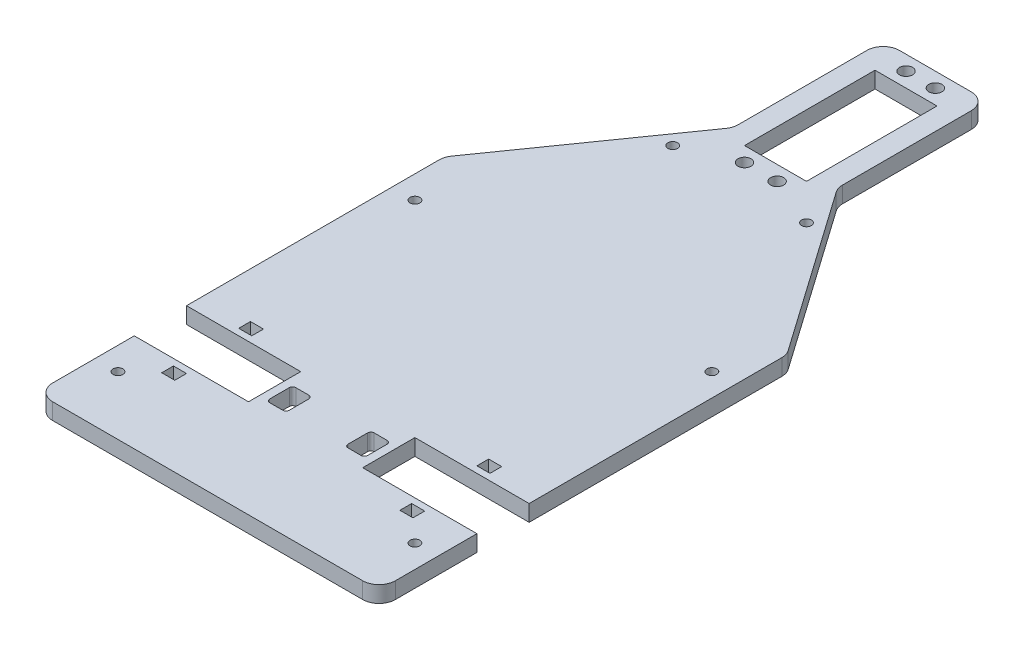
from build123d import *

# Parameters (mm, degrees)
BOSS_EXTRUDE1_DEPTH = 5
SKETCH2_R           = 2
SKETCH2_R_2         = 1.5
SKETCH2_W           = 19
SKETCH2_H           = 40
SKETCH2_W_2         = 3.995778709
SKETCH2_H_2         = 3.597560242
SKETCH2_W_3         = 35
SKETCH2_H_3         = 16
SKETCH2_W_4         = 6
SKETCH2_H_4         = 8
SKETCH2_H_5         = 3.6
SKETCH2_W_5         = 4
CUT_EXTRUDE1_DEPTH  = 7
FILLET1_R           = 5
FILLET2_R           = 5
FILLET3_R           = 5
FILLET4_R           = 5
FILLET5_R           = 5
FILLET6_R           = 5
FILLET8_R           = 1
FILLET9_R           = 1
FILLET10_R          = 5


with BuildPart() as part:
    # Sketch1 → Boss-Extrude1 (new body)
    with BuildSketch(Plane(origin=(0, 0, 0), x_dir=(1, 0, 0), z_dir=(0, 1, 0))):
        Polygon((-16, 108), (16, 108), (16, 62), (52.5, 10), (52.5, -115), (-52.5, -115), (-52.5, 10), (-16, 62), align=None)
    extrude(amount=BOSS_EXTRUDE1_DEPTH)

    # Sketch2 → Cut-Extrude1 (cut)
    with BuildSketch(Plane(origin=(0, 5, 0), x_dir=(1, 0, 0), z_dir=(0, 1, 0))):
        with Locations((-4.5, 103.5)):
            Circle(SKETCH2_R)
        with Locations((4.5, 103.5)):
            Circle(SKETCH2_R)
        with Locations((-5, 54.502551087)):
            Circle(SKETCH2_R)
        with Locations((5, 54.502551087)):
            Circle(SKETCH2_R)
        with Locations((-20.5, 48)):
            Circle(SKETCH2_R_2)
        with Locations((20.5, 48)):
            Circle(SKETCH2_R_2)
        with Locations((45.5, -6)):
            Circle(SKETCH2_R_2)
        with Locations((-45.5, -6)):
            Circle(SKETCH2_R_2)
        with Locations((45.5, -97)):
            Circle(SKETCH2_R_2)
        with Locations((-45.5, -97)):
            Circle(SKETCH2_R_2)
        with Locations((0, 79)):
            Rectangle(SKETCH2_W, SKETCH2_H)
        with Locations((-36.502110645, -65.201219879)):
            Rectangle(SKETCH2_W_2, SKETCH2_H_2)
        with Locations((-35, -77)):
            Rectangle(SKETCH2_W_3, SKETCH2_H_3)
        with Locations((35, -77)):
            Rectangle(SKETCH2_W_3, SKETCH2_H_3)
        with Locations((-12, -78)):
            Rectangle(SKETCH2_W_4, SKETCH2_H_4)
        with Locations((12, -78)):
            Rectangle(SKETCH2_W_4, SKETCH2_H_4)
        with Locations((-36.502110645, -88.8)):
            Rectangle(SKETCH2_W_2, SKETCH2_H_5)
        with Locations((36.5, -88.8)):
            Rectangle(SKETCH2_W_5, SKETCH2_H_5)
        with Locations((36.5, -65.2)):
            Rectangle(SKETCH2_W_5, SKETCH2_H_5)
    extrude(amount=-CUT_EXTRUDE1_DEPTH, mode=Mode.SUBTRACT)

    # Fillet1
    fillet1_edges = [part.edges().sort_by_distance(p)[0] for p in [
        (16, 2.5, -108),
    ]]
    fillet(fillet1_edges, radius=FILLET1_R)

    # Fillet2
    fillet2_edges = [part.edges().sort_by_distance(p)[0] for p in [
        (-16, 2.5, -108),
    ]]
    fillet(fillet2_edges, radius=FILLET2_R)

    # Fillet3
    fillet3_edges = [part.edges().sort_by_distance(p)[0] for p in [
        (52.5, 2.5, -10),
    ]]
    fillet(fillet3_edges, radius=FILLET3_R)

    # Fillet4
    fillet4_edges = [part.edges().sort_by_distance(p)[0] for p in [
        (-52.5, 2.5, -10),
    ]]
    fillet(fillet4_edges, radius=FILLET4_R)

    # Fillet5
    fillet5_edges = [part.edges().sort_by_distance(p)[0] for p in [
        (52.5, 2.5, 115),
    ]]
    fillet(fillet5_edges, radius=FILLET5_R)

    # Fillet6
    fillet6_edges = [part.edges().sort_by_distance(p)[0] for p in [
        (-52.5, 2.5, 115),
    ]]
    fillet(fillet6_edges, radius=FILLET6_R)

    # Fillet8
    fillet8_edges = [part.edges().sort_by_distance(p)[0] for p in [
        (15, 2.5, 74),
    ]]
    fillet(fillet8_edges, radius=FILLET8_R)

    # Fillet9
    fillet9_edges = [part.edges().sort_by_distance(p)[0] for p in [
        (-15, 2.5, 82),
        (-15, 2.5, 74),
        (-9, 2.5, 82),
        (-9, 2.5, 74),
        (9, 2.5, 82),
        (15, 2.5, 82),
        (9, 2.5, 74),
    ]]
    fillet(fillet9_edges, radius=FILLET9_R)

    # Fillet10
    fillet10_edges = [part.edges().sort_by_distance(p)[0] for p in [
        (-16, 2.5, -62),
        (16, 2.5, -62),
    ]]
    fillet(fillet10_edges, radius=FILLET10_R)


solid = part.part
